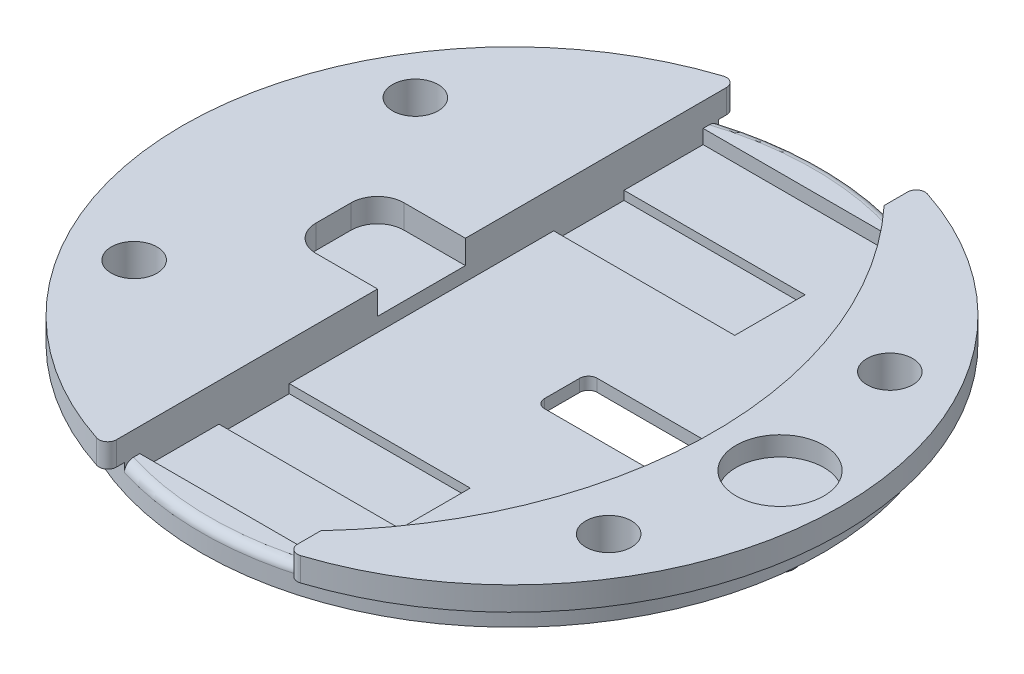
from build123d import *

# Parameters (mm, degrees)
SKETCH1_R           = 35.35
SKETCH1_R_2         = 2.6
SKETCH1_W           = 14
SKETCH1_H           = 6
BOSS_EXTRUDE1_DEPTH = 1.4
FILLET1_R           = 1
SKETCH3_R           = 35.35
SKETCH3_R_2         = 2.6
BOSS_EXTRUDE3_DEPTH = 1.6
SKETCH4_R           = 2.6
BOSS_EXTRUDE4_DEPTH = 2.7
SKETCH5_R           = 5
CUT_EXTRUDE1_DEPTH  = 2.2
SKETCH7_W           = 20.6
SKETCH7_H           = 8
CUT_EXTRUDE3_DEPTH  = 1
SKETCH8_R           = 1.9
BOSS_EXTRUDE6_DEPTH = 3.5
FILLET2_R           = 1
FILLET3_R           = 3


with BuildPart() as part:
    # Sketch1 → Boss-Extrude1 (new body)
    with BuildSketch(Plane(origin=(0, 0, 0), x_dir=(1, 0, 0), z_dir=(0, 1, 0))):
        with Locations(Location((0, 0, 0), (0, 0, 270))):
            Circle(SKETCH1_R)
        with Locations(Location((27, 16, 0), (0, 0, 270))):
            Circle(SKETCH1_R_2, mode=Mode.SUBTRACT)
        with Locations(Location((-27, 16, 0), (0, 0, 270))):
            Circle(SKETCH1_R_2, mode=Mode.SUBTRACT)
        with Locations(Location((-27, -16, 0), (0, 0, 270))):
            Circle(SKETCH1_R_2, mode=Mode.SUBTRACT)
        with Locations(Location((27, -16, 0), (0, 0, 270))):
            Circle(SKETCH1_R_2, mode=Mode.SUBTRACT)
        with Locations((12.7, 0)):
            Rectangle(SKETCH1_W, SKETCH1_H, mode=Mode.SUBTRACT)
    extrude(amount=BOSS_EXTRUDE1_DEPTH)

    # Fillet1
    fillet1_edges = [part.edges().sort_by_distance(p)[0] for p in [
        (5.7, 0.7, -3),
        (5.7, 0.7, 3),
        (19.7, 0.7, 3),
        (19.7, 0.7, -3),
    ]]
    fillet(fillet1_edges, radius=FILLET1_R)

    # Sketch3 → Boss-Extrude3 (add)
    with BuildSketch(Plane(origin=(0, 1.4, 0), x_dir=(1, 0, 0), z_dir=(0, 1, 0))):
        with Locations(Location((0, 0, 0), (0, 0, 270))):
            Circle(SKETCH3_R)
        with Locations(Location((27, 16, 0), (0, 0, 270))):
            Circle(SKETCH3_R_2, mode=Mode.SUBTRACT)
        with Locations(Location((27, -16, 0), (0, 0, 270))):
            Circle(SKETCH3_R_2, mode=Mode.SUBTRACT)
        with Locations(Location((-27, -16, 0), (0, 0, 270))):
            Circle(SKETCH3_R_2, mode=Mode.SUBTRACT)
        with Locations(Location((-27, 16, 0), (0, 0, 270))):
            Circle(SKETCH3_R_2, mode=Mode.SUBTRACT)
        with BuildLine():
            Line((-10.3, 32.05), (10.3, 32.05))
            ThreePointArc((10.3, 32.05), (22.922718258, 0), (10.3, -32.05))
            Line((10.3, -32.05), (-10.3, -32.05))
            Line((-10.3, -32.05), (-10.3, 32.05))
        make_face(mode=Mode.SUBTRACT)
    extrude(amount=BOSS_EXTRUDE3_DEPTH)

    # Sketch4 → Boss-Extrude4 (add)
    # profile 1 of 2: a face of its own
    with BuildSketch(Plane(origin=(0, 3, 0), x_dir=(1, 0, 0), z_dir=(0, 1, 0))):
        with BuildLine():
            Line((-10.3, 36.057731487), (-10.3, 5))
            Line((-10.3, 5), (-20.3, 5))
            Line((-20.3, 5), (-20.3, -5))
            Line((-20.3, -5), (-10.3, -5))
            Line((-10.3, -5), (-10.3, -36.057731487))
            ThreePointArc((-10.3, -36.057731487), (-37.5, 0), (-10.3, 36.057731487))
        make_face()
        with Locations(Location((-27, 16, 0), (0, 0, 270))):
            Circle(SKETCH4_R, mode=Mode.SUBTRACT)
        with Locations(Location((-27, -16, 0), (0, 0, 270))):
            Circle(SKETCH4_R, mode=Mode.SUBTRACT)
    # profile 2 of 2: a face of its own
    with BuildSketch(Plane(origin=(0, 3, 0), x_dir=(1, 0, 0), z_dir=(0, 1, 0))):
        with BuildLine():
            Line((10.3, 32.05), (10.3, 36.057731487))
            ThreePointArc((10.3, 36.057731487), (37.5, 0), (10.3, -36.057731487))
            Line((10.3, -36.057731487), (10.3, -32.05))
            ThreePointArc((10.3, -32.05), (22.922718258, 0), (10.3, 32.05))
        make_face()
        with Locations(Location((27, -16, 0), (0, 0, 270))):
            Circle(SKETCH4_R, mode=Mode.SUBTRACT)
        with Locations(Location((27, 16, 0), (0, 0, 270))):
            Circle(SKETCH4_R, mode=Mode.SUBTRACT)
    extrude(amount=BOSS_EXTRUDE4_DEPTH)

    # Sketch5 → Cut-Extrude1 (cut)
    with BuildSketch(Plane(origin=(0, 5.7, 0), x_dir=(1, 0, 0), z_dir=(0, 1, 0))):
        with Locations(Location((30.5, 0, 0), (0, 0, 270))):
            Circle(SKETCH5_R)
    extrude(amount=-CUT_EXTRUDE1_DEPTH, mode=Mode.SUBTRACT)

    # Sketch7 → Cut-Extrude3 (cut)
    with BuildSketch(Plane(origin=(0, 1.4, 0), x_dir=(1, 0, 0), z_dir=(0, 1, 0))):
        with Locations((0, -19.05)):
            Rectangle(SKETCH7_W, SKETCH7_H)
        with Locations((0, 19.05)):
            Rectangle(SKETCH7_W, SKETCH7_H)
    extrude(amount=-CUT_EXTRUDE3_DEPTH, mode=Mode.SUBTRACT)

    # Sketch8 → Boss-Extrude6 (add)
    with BuildSketch(Plane.XZ):
        with Locations(Location((30.5, 0, 0), (0, 0, 90))):
            Circle(SKETCH8_R)
    extrude(amount=BOSS_EXTRUDE6_DEPTH)

    # Fillet2
    # the kernel refuses this fillet: 1 mm, written as the material it takes off along each edge
    with BuildSketch(Plane(origin=(0, 3, 0), x_dir=(0, 0, 1), z_dir=(-1, 0, 0))) as fillet2_piece_1_section:
        with BuildLine():
            CenterArc((35.35 - FILLET2_R, -FILLET2_R), FILLET2_R, 0, 90)
            Line((35.35 - FILLET2_R, 0), (35.35, 0))
            Line((35.35, 0), (35.35, -FILLET2_R))
        make_face()
    fillet2_piece_1 = revolve(axis=Axis((0, 3, 0), (0, 1, 0)), revolution_arc=20.992206164, mode=Mode.PRIVATE)
    fillet2_piece_1 = split(fillet2_piece_1, bisect_by=Plane(origin=(10.3, 2.776649723, 34.610378642), z_dir=(-1, 0, 0)), keep=Keep.TOP, mode=Mode.PRIVATE)
    add(fillet2_piece_1, mode=Mode.SUBTRACT)
    with BuildSketch(Plane(origin=(-10.3, -0.42335266, -36.057731487), x_dir=(0, 0, 1), z_dir=(0, 1, 0)), Plane(origin=(10.3, -0.42335266, 36.057731487), x_dir=(0, 0, -1), z_dir=(0, 1, 0))) as fillet2_piece_2:
        with BuildLine():
            CenterArc((1.350959814, -1), FILLET2_R, 90, 108.034465952)
            ThreePointArc((0.400089357, -1.309589041), (0.1940666, -0.656620869), (0, 0))
            Line((0, 0), (1.350959814, 0))
        make_face()
    extrude(amount=9.546705321, mode=Mode.SUBTRACT)
    with BuildSketch(Plane(origin=(-10.3, -0.42335266, 36.057731487), x_dir=(0, 0, -1), z_dir=(0, 1, 0)), Plane(origin=(10.3, -0.42335266, -36.057731487), x_dir=(0, 0, 1), z_dir=(0, 1, 0))) as fillet2_piece_3:
        with BuildLine():
            CenterArc((1.350959814, 1), FILLET2_R, 161.965534048, 108.034465952)
            ThreePointArc((0.400089357, 1.309589041), (0.1940666, 0.656620869), (0, 0))
            Line((0, 0), (1.350959814, 0))
        make_face()
    extrude(amount=9.546705321, mode=Mode.SUBTRACT)
    with BuildSketch(Plane(origin=(30.5, -3.5, 0), x_dir=(0, 0, 1), z_dir=(1, 0, 0))) as fillet2_piece_4:
        with BuildLine():
            CenterArc((1.9 - FILLET2_R, -FILLET2_R), FILLET2_R, 0, 90)
            Line((1.9 - FILLET2_R, 0), (1.9, 0))
            Line((1.9, 0), (1.9, -FILLET2_R))
        make_face()
    revolve(axis=Axis((30.5, -3.5, 0), (0, -1, 0)), mode=Mode.SUBTRACT)
    with BuildSketch(Plane(origin=(0, 3, 0), x_dir=(0.3582437714618883, 0, -0.9336280845222912), z_dir=(0.9336280845222912, 0, 0.3582437714618883))) as fillet2_piece_5_section:
        with BuildLine():
            CenterArc((35.35 - FILLET2_R, -FILLET2_R), FILLET2_R, 0, 90)
            Line((35.35 - FILLET2_R, 0), (35.35, 0))
            Line((35.35, 0), (35.35, -FILLET2_R))
        make_face()
    fillet2_piece_5 = revolve(axis=Axis((0, 3, 0), (0, 1, 0)), revolution_arc=41.984758253, mode=Mode.PRIVATE)
    fillet2_piece_5 = split(fillet2_piece_5, bisect_by=Plane(origin=(-10.3, 2.718769388, -35.068769388), z_dir=(1, 0, 0)), keep=Keep.TOP, mode=Mode.PRIVATE)
    fillet2_piece_5 = split(fillet2_piece_5, bisect_by=Plane(origin=(10.3, 2.718769388, -35.068769388), z_dir=(-1, 0, 0)), keep=Keep.TOP, mode=Mode.PRIVATE)
    add(fillet2_piece_5, mode=Mode.SUBTRACT)
    with BuildSketch(Plane(origin=(0, 3, 0), x_dir=(-0.35824095305440445, 0, 0.9336291659725889), z_dir=(-0.9336291659725889, 0, -0.35824095305440445))) as fillet2_piece_6_section:
        with BuildLine():
            CenterArc((35.35 - FILLET2_R, -FILLET2_R), FILLET2_R, 0, 90)
            Line((35.35 - FILLET2_R, 0), (35.35, 0))
            Line((35.35, 0), (35.35, -FILLET2_R))
        make_face()
    fillet2_piece_6 = revolve(axis=Axis((0, 3, 0), (0, 1, 0)), revolution_arc=20.992206164, mode=Mode.PRIVATE)
    fillet2_piece_6 = split(fillet2_piece_6, bisect_by=Plane(origin=(-10.3, 2.776650175, 34.610378573), z_dir=(1, 0, 0)), keep=Keep.TOP, mode=Mode.PRIVATE)
    add(fillet2_piece_6, mode=Mode.SUBTRACT)

    # Fillet3
    fillet3_edges = [part.edges().sort_by_distance(p)[0] for p in [
        (-20.3, 4.35, 5),
        (-20.3, 4.35, -5),
    ]]
    fillet(fillet3_edges, radius=FILLET3_R)


solid = part.part
